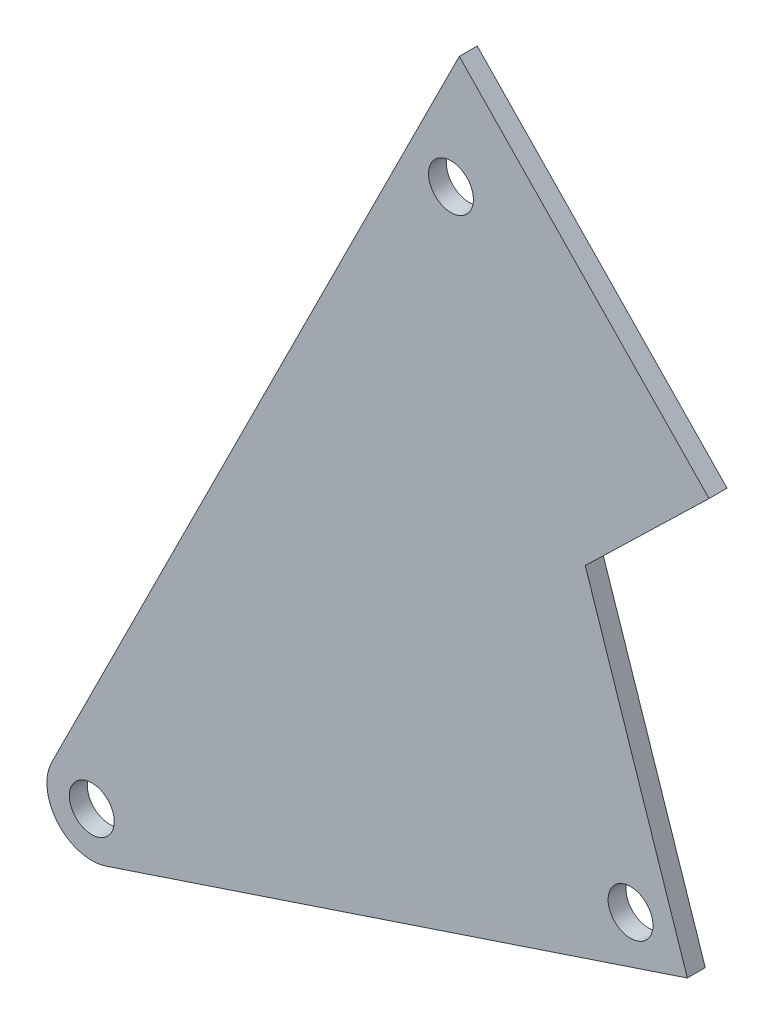
from build123d import *

# Parameters (mm, degrees)
SKETCH1_R           = 3.175
BOSS_EXTRUDE1_DEPTH = 2.54
FILLET1_R           = 6.35


with BuildPart() as part:
    # Sketch1 → Boss-Extrude1 (new body)
    with BuildSketch(Plane.XY):
        Polygon((-24.223713703, 118.151604251), (-88.735511623, -10.871991588), (8.032185257, 21.383907372), (-6.404519195, 64.694020727), (11.113552526, 81.656157748), align=None)
        with Locations((-76.2, 0)):
            Circle(SKETCH1_R, mode=Mode.SUBTRACT)
        with Locations((0, 25.4)):
            Circle(SKETCH1_R, mode=Mode.SUBTRACT)
        with Locations((-25.4, 101.6)):
            Circle(SKETCH1_R, mode=Mode.SUBTRACT)
    extrude(amount=BOSS_EXTRUDE1_DEPTH)

    # Fillet1
    fillet1_edges = [part.edges().sort_by_distance(p)[0] for p in [
        (-88.735511623, -10.871991588, 1.27),
    ]]
    fillet(fillet1_edges, radius=FILLET1_R)


solid = part.part
